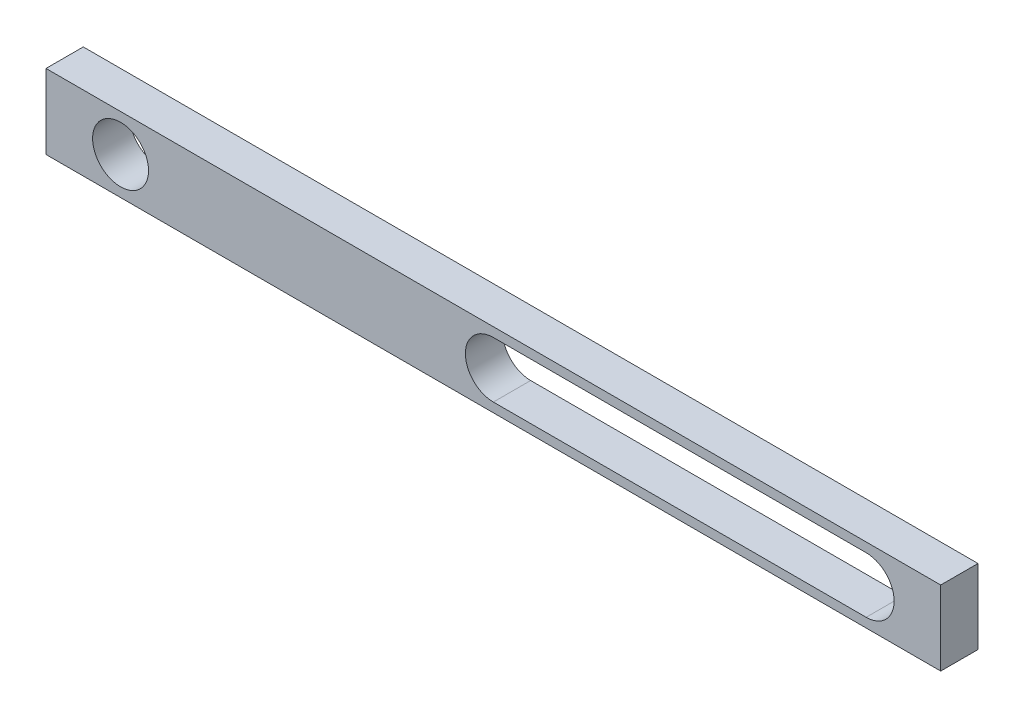
from build123d import *

# Parameters (mm, degrees)
SKETCH2_W           = 152.4
SKETCH2_H           = 12.7
SKETCH2_R           = 4.7625
BOSS_EXTRUDE1_DEPTH = 6.35


with BuildPart() as part:
    # Sketch2 → Boss-Extrude1 (new body)
    with BuildSketch(Plane.XY):
        Rectangle(SKETCH2_W, SKETCH2_H)
        with Locations((-63.5, 0)):
            Circle(SKETCH2_R, mode=Mode.SUBTRACT)
        with BuildLine():
            Line((0, -4.7625), (63.5, -4.7625))
            ThreePointArc((63.5, -4.7625), (68.2625, 0), (63.5, 4.7625))
            Line((63.5, 4.7625), (0, 4.7625))
            ThreePointArc((0, 4.7625), (-4.7625, 0), (0, -4.7625))
        make_face(mode=Mode.SUBTRACT)
    extrude(amount=BOSS_EXTRUDE1_DEPTH)


solid = part.part
